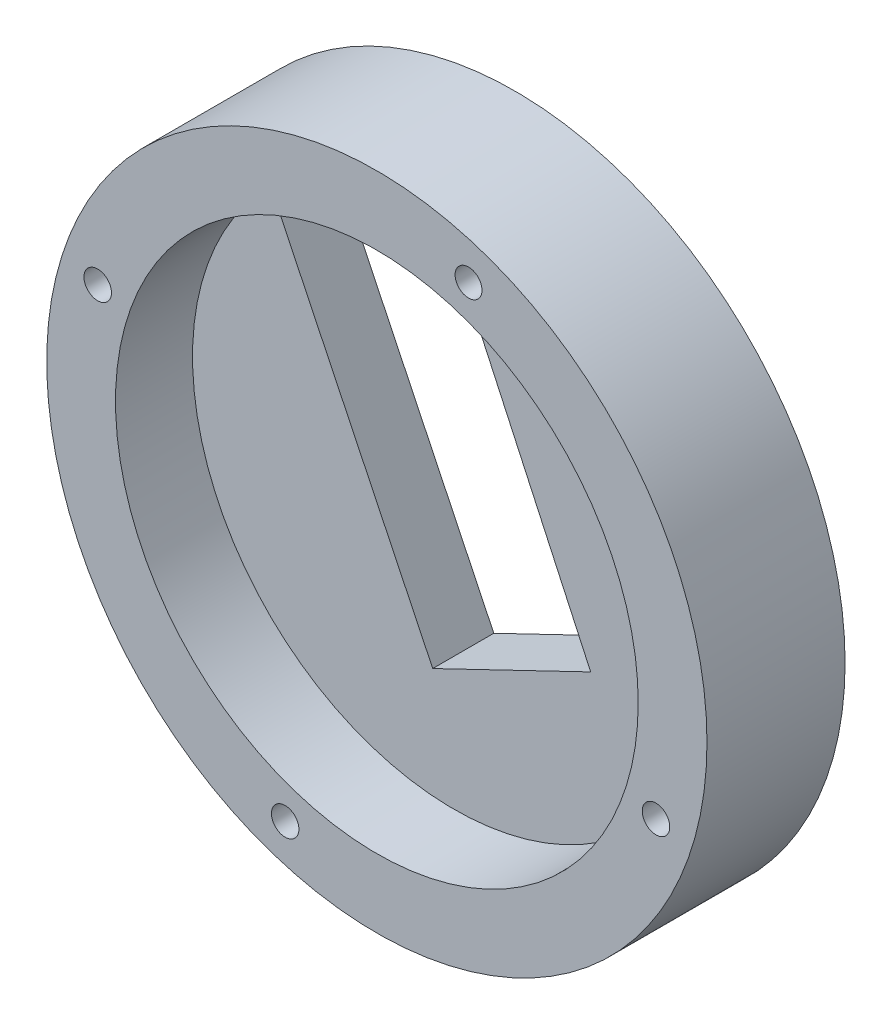
from build123d import *

# Parameters (mm, degrees)
SKETCH1_R               = 60
BOSS_EXTRUDE1_DEPTH     = 25.1
SKETCH3_R               = 47.5
CUT_EXTRUDE2_DEPTH      = 14
CUT_EXTRUDE5_DEPTH      = 89.487343728
CUT_EXTRUDE5_DEPTH_BACK = 89.487343728
SKETCH2_R               = 2.494998654
SKETCH2_R_2             = 2.5
SKETCH2_R_3             = 2.444443829
SKETCH6_R               = 3
CUT_EXTRUDE6_DEPTH      = 6
CUT_EXTRUDE7_DEPTH      = 87
CUT_EXTRUDE7_DEPTH_BACK = 87


with BuildPart() as part:
    # Sketch1 → Boss-Extrude1 (new body)
    with BuildSketch(Plane.XY):
        Circle(SKETCH1_R)
    extrude(amount=BOSS_EXTRUDE1_DEPTH)

    # Sketch3 → Cut-Extrude2 (cut)
    with BuildSketch(Plane.XY.offset(25.1)):
        Circle(SKETCH3_R)
    extrude(amount=-CUT_EXTRUDE2_DEPTH, mode=Mode.SUBTRACT)

    # Sketch2 → Cut-Extrude5 (cut, two sides: drawn at the far end of the back side and taken through both)
    with BuildSketch(Plane.XY.offset(25.1).offset(-CUT_EXTRUDE5_DEPTH_BACK)):
        with Locations((-16.664697145, -50.733104448)):
            Circle(SKETCH2_R)
        with Locations((-50.733105114, 16.664696544)):
            Circle(SKETCH2_R_2)
        with Locations((16.664695878, 50.733104512)):
            Circle(SKETCH2_R_3)
        with Locations((50.733103846, -16.66469648)):
            Circle(SKETCH2_R_2)
    extrude(amount=CUT_EXTRUDE5_DEPTH + CUT_EXTRUDE5_DEPTH_BACK, mode=Mode.SUBTRACT)

    # Sketch6 → Cut-Extrude6 (cut)
    with BuildSketch(Plane(origin=(0, 0, 0), x_dir=(-1, 0, 0), z_dir=(0, 0, -1))):
        with Locations((11.973502988, 47.212610548)):
            Circle(SKETCH6_R)
        with Locations((27.381285989, 40.029281029)):
            Circle(SKETCH6_R)
        with Locations((-19.717656658, -20.762902692)):
            Circle(SKETCH6_R)
        with Locations((-4.309873657, -27.946232212)):
            Circle(SKETCH6_R)
    extrude(amount=-CUT_EXTRUDE6_DEPTH, mode=Mode.SUBTRACT)

    # Sketch7 → Cut-Extrude7 (cut, two sides: drawn at the far end of the back side and taken through both)
    with BuildSketch(Plane.XY.offset(11.1).offset(-CUT_EXTRUDE7_DEPTH_BACK)):
        Polygon((-32.722381774, 32.714358343), (-3.845549598, -27.273283804), (24.859322702, -13.455341469), (-3.0425496, 47.001626555), align=None)
    extrude(amount=CUT_EXTRUDE7_DEPTH + CUT_EXTRUDE7_DEPTH_BACK, mode=Mode.SUBTRACT)


solid = part.part
